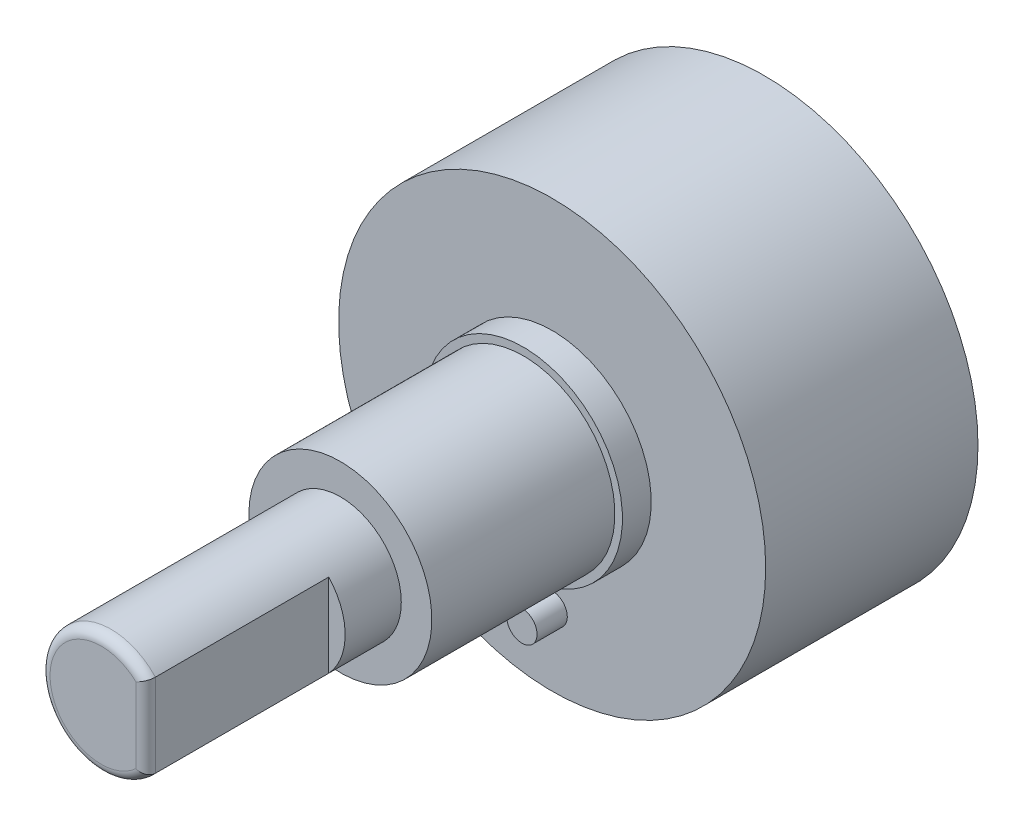
from build123d import *

# Parameters (mm, degrees)
SKETCH1_R           = 11.1125
BOSS_EXTRUDE1_DEPTH = 11.049
SKETCH2_R           = 5.1562
BOSS_EXTRUDE2_DEPTH = 1.4986
SKETCH3_R           = 4.7625
BOSS_EXTRUDE3_DEPTH = 9.525
SKETCH4_R           = 3.17119
BOSS_EXTRUDE5_DEPTH = 12.446
CUT_EXTRUDE1_START  = -9.525
CUT_EXTRUDE1_DEPTH  = 9.525
SKETCH6_R           = 0.7874
BOSS_EXTRUDE6_DEPTH = 1.5748
SKETCH7_R           = 0.7874
BOSS_EXTRUDE7_DEPTH = 3.175
FILLET1_R           = 0.508


with BuildPart() as part:
    # Sketch1 → Boss-Extrude1 (new body)
    with BuildSketch(Plane.XY):
        Circle(SKETCH1_R)
    extrude(amount=-BOSS_EXTRUDE1_DEPTH)

    # Sketch2 → Boss-Extrude2 (add)
    with BuildSketch(Plane.XY):
        Circle(SKETCH2_R)
    extrude(amount=BOSS_EXTRUDE2_DEPTH)

    # Sketch3 → Boss-Extrude3 (add)
    with BuildSketch(Plane.XY.offset(1.4986)):
        Circle(SKETCH3_R)
    extrude(amount=BOSS_EXTRUDE3_DEPTH)

    # Sketch4 → Boss-Extrude5 (add)
    with BuildSketch(Plane.XY.offset(11.0236)):
        Circle(SKETCH4_R)
    extrude(amount=BOSS_EXTRUDE5_DEPTH)

    # Sketch5 → Cut-Extrude1 (cut)
    with BuildSketch(Plane.XY.offset(23.4696).offset(CUT_EXTRUDE1_START)):
        with BuildLine():
            Line((2.31521, -2.167082987), (2.31521, 2.167082987))
            ThreePointArc((2.31521, 2.167082987), (3.17119, 0), (2.31521, -2.167082987))
        make_face()
    extrude(amount=CUT_EXTRUDE1_DEPTH, mode=Mode.SUBTRACT)

    # Sketch6 → Boss-Extrude6 (add)
    with BuildSketch(Plane.XY):
        with Locations((0, -7.366)):
            Circle(SKETCH6_R)
    extrude(amount=BOSS_EXTRUDE6_DEPTH)

    # Sketch7 → Boss-Extrude7 (add)
    with BuildSketch(Plane(origin=(0, 0, -11.049), x_dir=(-1, 0, 0), z_dir=(0, 0, -1))):
        with Locations((0, -5.5245)):
            Circle(SKETCH7_R)
        with Locations((-3.9116, 3.901215925)):
            Circle(SKETCH7_R)
        with Locations((3.9116, 3.901215925)):
            Circle(SKETCH7_R)
    extrude(amount=BOSS_EXTRUDE7_DEPTH)

    # Fillet1
    fillet1_edges = [part.edges().sort_by_distance(p)[0] for p in [
        (-3.17119, 0, 23.4696),
        (2.31521, 0, 23.4696),
    ]]
    fillet(fillet1_edges, radius=FILLET1_R)


solid = part.part
